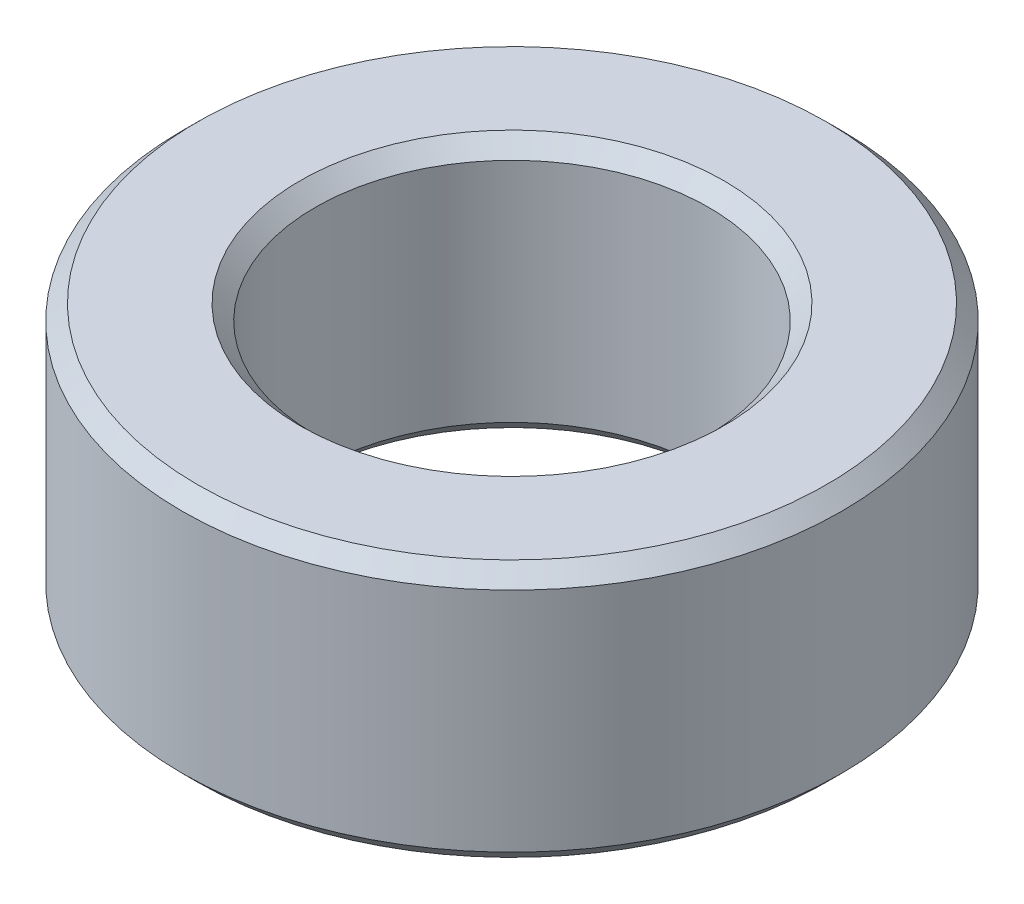
from build123d import *


with BuildPart() as part:
    # Sketch2 → Revolve1 (revolve)
    with BuildSketch(Plane(origin=(0, 0, 0), x_dir=(0, 0, -1), z_dir=(1, 0, 0))):
        Polygon((-32.25, 11.1), (-30.75, 12.6), (-20.75, 12.6), (-19.25, 11.1), (-19.25, -11.1), (-20.75, -12.6), (-30.75, -12.6), (-32.25, -11.1), align=None)
    revolve(axis=Axis((0, 44.566477302, 0), (0, -1, 0)))


solid = part.part
